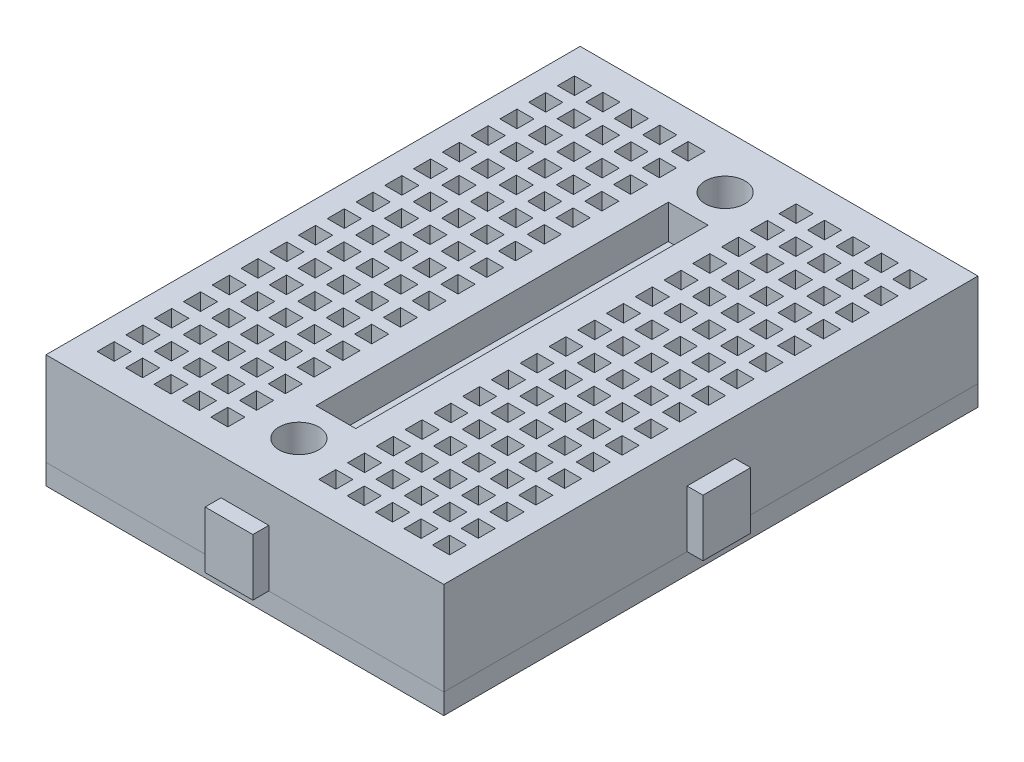
from build123d import *
from build123d.topology import SkipClean

# Parameters (mm, degrees)
SKETCH2_W           = 17.5
SKETCH2_H           = 47
BOSS_EXTRUDE1_DEPTH = 5.2
SKETCH3_W           = 1.5
SKETCH3_H           = 1.5
BOSS_EXTRUDE2_DEPTH = 3
SKETCH4_R           = 1
CUT_EXTRUDE1_DEPTH  = 30.758024128
SKETCH7_W           = 4.2
SKETCH7_H           = 5
BOSS_EXTRUDE4_DEPTH = 1.4
SKETCH8_W           = 4.2
SKETCH8_H           = 5
CUT_EXTRUDE2_DEPTH  = 1.7
SKETCH9_W           = 4.2
SKETCH9_H           = 5
BOSS_EXTRUDE5_DEPTH = 1.4
SKETCH10_W          = 4.2
SKETCH10_H          = 5
CUT_EXTRUDE3_DEPTH  = 1.7
SKETCH6_W           = 35
SKETCH6_H           = 47
ADHESIVE_DEPTH      = 1.8


with BuildPart() as part:
    # Sketch2 → Boss-Extrude1 (new body)
    with BuildSketch(Plane(origin=(0, 0, 0), x_dir=(1, 0, 0), z_dir=(0, 1, 0))):
        with Locations((-8.75, 0)):
            Rectangle(SKETCH2_W, SKETCH2_H)
    boss_extrude1 = extrude(amount=BOSS_EXTRUDE1_DEPTH)

    # Sketch3 → Boss-Extrude2 (add)
    with BuildSketch(Plane(origin=(0, 5.2, 0), x_dir=(1, 0, 0), z_dir=(0, 1, 0))):
        with BuildLine():
            Line((0, -17), (0, -15.5))
            Line((0, -15.5), (-1.75, -15.5))
            Line((-1.75, -15.5), (-1.75, 15.5))
            Line((-1.75, 15.5), (0, 15.5))
            Line((0, 15.5), (0, 17))
            ThreePointArc((0, 17), (-1.75, 18.75), (0, 20.5))
            Line((0, 20.5), (0, 23.5))
            Line((0, 23.5), (-17.5, 23.5))
            Line((-17.5, 23.5), (-17.5, -23.5))
            Line((-17.5, -23.5), (0, -23.5))
            Line((0, -23.5), (0, -20.5))
            ThreePointArc((0, -20.5), (-1.75, -18.75), (0, -17))
        make_face()
        with Locations((-14.75, -20.25)):
            Rectangle(SKETCH3_W, SKETCH3_H, mode=Mode.SUBTRACT)
        with Locations((-14.75, -17.71875)):
            Rectangle(SKETCH3_W, SKETCH3_H, mode=Mode.SUBTRACT)
        with Locations((-14.75, -15.1875)):
            Rectangle(SKETCH3_W, SKETCH3_H, mode=Mode.SUBTRACT)
        with Locations((-14.75, -12.65625)):
            Rectangle(SKETCH3_W, SKETCH3_H, mode=Mode.SUBTRACT)
        with Locations((-12.25, -20.25)):
            Rectangle(SKETCH3_W, SKETCH3_H, mode=Mode.SUBTRACT)
        with Locations((-12.25, -17.71875)):
            Rectangle(SKETCH3_W, SKETCH3_H, mode=Mode.SUBTRACT)
        with Locations((-9.75, -20.25)):
            Rectangle(SKETCH3_W, SKETCH3_H, mode=Mode.SUBTRACT)
        with Locations((-9.75, -17.71875)):
            Rectangle(SKETCH3_W, SKETCH3_H, mode=Mode.SUBTRACT)
        with Locations((-12.25, -15.1875)):
            Rectangle(SKETCH3_W, SKETCH3_H, mode=Mode.SUBTRACT)
        with Locations((-12.25, -12.65625)):
            Rectangle(SKETCH3_W, SKETCH3_H, mode=Mode.SUBTRACT)
        with Locations((-9.75, -15.1875)):
            Rectangle(SKETCH3_W, SKETCH3_H, mode=Mode.SUBTRACT)
        with Locations((-9.75, -12.65625)):
            Rectangle(SKETCH3_W, SKETCH3_H, mode=Mode.SUBTRACT)
        with Locations((-14.75, -10.125)):
            Rectangle(SKETCH3_W, SKETCH3_H, mode=Mode.SUBTRACT)
        with Locations((-14.75, -7.59375)):
            Rectangle(SKETCH3_W, SKETCH3_H, mode=Mode.SUBTRACT)
        with Locations((-14.75, -5.0625)):
            Rectangle(SKETCH3_W, SKETCH3_H, mode=Mode.SUBTRACT)
        with Locations((-14.75, -2.53125)):
            Rectangle(SKETCH3_W, SKETCH3_H, mode=Mode.SUBTRACT)
        with Locations((-12.25, -10.125)):
            Rectangle(SKETCH3_W, SKETCH3_H, mode=Mode.SUBTRACT)
        with Locations((-12.25, -7.59375)):
            Rectangle(SKETCH3_W, SKETCH3_H, mode=Mode.SUBTRACT)
        with Locations((-9.75, -10.125)):
            Rectangle(SKETCH3_W, SKETCH3_H, mode=Mode.SUBTRACT)
        with Locations((-9.75, -7.59375)):
            Rectangle(SKETCH3_W, SKETCH3_H, mode=Mode.SUBTRACT)
        with Locations((-12.25, -5.0625)):
            Rectangle(SKETCH3_W, SKETCH3_H, mode=Mode.SUBTRACT)
        with Locations((-12.25, -2.53125)):
            Rectangle(SKETCH3_W, SKETCH3_H, mode=Mode.SUBTRACT)
        with Locations((-9.75, -5.0625)):
            Rectangle(SKETCH3_W, SKETCH3_H, mode=Mode.SUBTRACT)
        with Locations((-9.75, -2.53125)):
            Rectangle(SKETCH3_W, SKETCH3_H, mode=Mode.SUBTRACT)
        with Locations((-7.25, -20.25)):
            Rectangle(SKETCH3_W, SKETCH3_H, mode=Mode.SUBTRACT)
        with Locations((-7.25, -17.71875)):
            Rectangle(SKETCH3_W, SKETCH3_H, mode=Mode.SUBTRACT)
        with Locations((-4.75, -20.25)):
            Rectangle(SKETCH3_W, SKETCH3_H, mode=Mode.SUBTRACT)
        with Locations((-4.75, -17.71875)):
            Rectangle(SKETCH3_W, SKETCH3_H, mode=Mode.SUBTRACT)
        with Locations((-7.25, -15.1875)):
            Rectangle(SKETCH3_W, SKETCH3_H, mode=Mode.SUBTRACT)
        with Locations((-7.25, -12.65625)):
            Rectangle(SKETCH3_W, SKETCH3_H, mode=Mode.SUBTRACT)
        with Locations((-4.75, -15.1875)):
            Rectangle(SKETCH3_W, SKETCH3_H, mode=Mode.SUBTRACT)
        with Locations((-4.75, -12.65625)):
            Rectangle(SKETCH3_W, SKETCH3_H, mode=Mode.SUBTRACT)
        with Locations((-7.25, -10.125)):
            Rectangle(SKETCH3_W, SKETCH3_H, mode=Mode.SUBTRACT)
        with Locations((-7.25, -7.59375)):
            Rectangle(SKETCH3_W, SKETCH3_H, mode=Mode.SUBTRACT)
        with Locations((-4.75, -10.125)):
            Rectangle(SKETCH3_W, SKETCH3_H, mode=Mode.SUBTRACT)
        with Locations((-4.75, -7.59375)):
            Rectangle(SKETCH3_W, SKETCH3_H, mode=Mode.SUBTRACT)
        with Locations((-7.25, -5.0625)):
            Rectangle(SKETCH3_W, SKETCH3_H, mode=Mode.SUBTRACT)
        with Locations((-7.25, -2.53125)):
            Rectangle(SKETCH3_W, SKETCH3_H, mode=Mode.SUBTRACT)
        with Locations((-4.75, -5.0625)):
            Rectangle(SKETCH3_W, SKETCH3_H, mode=Mode.SUBTRACT)
        with Locations((-4.75, -2.53125)):
            Rectangle(SKETCH3_W, SKETCH3_H, mode=Mode.SUBTRACT)
        with Locations((-14.75, 0)):
            Rectangle(SKETCH3_W, SKETCH3_H, mode=Mode.SUBTRACT)
        with Locations((-14.75, 2.53125)):
            Rectangle(SKETCH3_W, SKETCH3_H, mode=Mode.SUBTRACT)
        with Locations((-14.75, 5.0625)):
            Rectangle(SKETCH3_W, SKETCH3_H, mode=Mode.SUBTRACT)
        with Locations((-14.75, 7.59375)):
            Rectangle(SKETCH3_W, SKETCH3_H, mode=Mode.SUBTRACT)
        with Locations((-14.75, 10.125)):
            Rectangle(SKETCH3_W, SKETCH3_H, mode=Mode.SUBTRACT)
        with Locations((-12.25, 0)):
            Rectangle(SKETCH3_W, SKETCH3_H, mode=Mode.SUBTRACT)
        with Locations((-12.25, 2.53125)):
            Rectangle(SKETCH3_W, SKETCH3_H, mode=Mode.SUBTRACT)
        with Locations((-12.25, 5.0625)):
            Rectangle(SKETCH3_W, SKETCH3_H, mode=Mode.SUBTRACT)
        with Locations((-9.75, 0)):
            Rectangle(SKETCH3_W, SKETCH3_H, mode=Mode.SUBTRACT)
        with Locations((-9.75, 2.53125)):
            Rectangle(SKETCH3_W, SKETCH3_H, mode=Mode.SUBTRACT)
        with Locations((-9.75, 5.0625)):
            Rectangle(SKETCH3_W, SKETCH3_H, mode=Mode.SUBTRACT)
        with Locations((-12.25, 7.59375)):
            Rectangle(SKETCH3_W, SKETCH3_H, mode=Mode.SUBTRACT)
        with Locations((-12.25, 10.125)):
            Rectangle(SKETCH3_W, SKETCH3_H, mode=Mode.SUBTRACT)
        with Locations((-9.75, 7.59375)):
            Rectangle(SKETCH3_W, SKETCH3_H, mode=Mode.SUBTRACT)
        with Locations((-9.75, 10.125)):
            Rectangle(SKETCH3_W, SKETCH3_H, mode=Mode.SUBTRACT)
        with Locations((-14.75, 12.65625)):
            Rectangle(SKETCH3_W, SKETCH3_H, mode=Mode.SUBTRACT)
        with Locations((-14.75, 15.1875)):
            Rectangle(SKETCH3_W, SKETCH3_H, mode=Mode.SUBTRACT)
        with Locations((-14.75, 17.71875)):
            Rectangle(SKETCH3_W, SKETCH3_H, mode=Mode.SUBTRACT)
        with Locations((-14.75, 20.25)):
            Rectangle(SKETCH3_W, SKETCH3_H, mode=Mode.SUBTRACT)
        with Locations((-12.25, 12.65625)):
            Rectangle(SKETCH3_W, SKETCH3_H, mode=Mode.SUBTRACT)
        with Locations((-12.25, 15.1875)):
            Rectangle(SKETCH3_W, SKETCH3_H, mode=Mode.SUBTRACT)
        with Locations((-9.75, 12.65625)):
            Rectangle(SKETCH3_W, SKETCH3_H, mode=Mode.SUBTRACT)
        with Locations((-9.75, 15.1875)):
            Rectangle(SKETCH3_W, SKETCH3_H, mode=Mode.SUBTRACT)
        with Locations((-12.25, 17.71875)):
            Rectangle(SKETCH3_W, SKETCH3_H, mode=Mode.SUBTRACT)
        with Locations((-12.25, 20.25)):
            Rectangle(SKETCH3_W, SKETCH3_H, mode=Mode.SUBTRACT)
        with Locations((-9.75, 17.71875)):
            Rectangle(SKETCH3_W, SKETCH3_H, mode=Mode.SUBTRACT)
        with Locations((-9.75, 20.25)):
            Rectangle(SKETCH3_W, SKETCH3_H, mode=Mode.SUBTRACT)
        with Locations((-7.25, 0)):
            Rectangle(SKETCH3_W, SKETCH3_H, mode=Mode.SUBTRACT)
        with Locations((-7.25, 2.53125)):
            Rectangle(SKETCH3_W, SKETCH3_H, mode=Mode.SUBTRACT)
        with Locations((-7.25, 5.0625)):
            Rectangle(SKETCH3_W, SKETCH3_H, mode=Mode.SUBTRACT)
        with Locations((-4.75, 0)):
            Rectangle(SKETCH3_W, SKETCH3_H, mode=Mode.SUBTRACT)
        with Locations((-4.75, 2.53125)):
            Rectangle(SKETCH3_W, SKETCH3_H, mode=Mode.SUBTRACT)
        with Locations((-4.75, 5.0625)):
            Rectangle(SKETCH3_W, SKETCH3_H, mode=Mode.SUBTRACT)
        with Locations((-7.25, 7.59375)):
            Rectangle(SKETCH3_W, SKETCH3_H, mode=Mode.SUBTRACT)
        with Locations((-7.25, 10.125)):
            Rectangle(SKETCH3_W, SKETCH3_H, mode=Mode.SUBTRACT)
        with Locations((-4.75, 7.59375)):
            Rectangle(SKETCH3_W, SKETCH3_H, mode=Mode.SUBTRACT)
        with Locations((-4.75, 10.125)):
            Rectangle(SKETCH3_W, SKETCH3_H, mode=Mode.SUBTRACT)
        with Locations((-7.25, 12.65625)):
            Rectangle(SKETCH3_W, SKETCH3_H, mode=Mode.SUBTRACT)
        with Locations((-7.25, 15.1875)):
            Rectangle(SKETCH3_W, SKETCH3_H, mode=Mode.SUBTRACT)
        with Locations((-4.75, 12.65625)):
            Rectangle(SKETCH3_W, SKETCH3_H, mode=Mode.SUBTRACT)
        with Locations((-4.75, 15.1875)):
            Rectangle(SKETCH3_W, SKETCH3_H, mode=Mode.SUBTRACT)
        with Locations((-7.25, 17.71875)):
            Rectangle(SKETCH3_W, SKETCH3_H, mode=Mode.SUBTRACT)
        with Locations((-7.25, 20.25)):
            Rectangle(SKETCH3_W, SKETCH3_H, mode=Mode.SUBTRACT)
        with Locations((-4.75, 17.71875)):
            Rectangle(SKETCH3_W, SKETCH3_H, mode=Mode.SUBTRACT)
        with Locations((-4.75, 20.25)):
            Rectangle(SKETCH3_W, SKETCH3_H, mode=Mode.SUBTRACT)
    boss_extrude2 = extrude(amount=BOSS_EXTRUDE2_DEPTH)

    # Mirror1: Boss-Extrude1, Boss-Extrude2 across plane
    with SkipClean():  # the faces are left unmerged after this step: merging them gives an invalid solid
        add(boss_extrude1.mirror(Plane(origin=(0, 5.2, -23.5), x_dir=(0, 0, 1), z_dir=(-1, 0, 0))))
        add(boss_extrude2.mirror(Plane(origin=(0, 5.2, -23.5), x_dir=(0, 0, 1), z_dir=(-1, 0, 0))))

    # Sketch4 → Cut-Extrude1 (cut, through all)
    with SkipClean():  # the faces are left unmerged after this step: merging them gives an invalid solid
        with BuildSketch(Plane(origin=(0, 5.2, 0), x_dir=(1, 0, 0), z_dir=(0, 1, 0))):
            with Locations((0, 18.75)):
                Circle(SKETCH4_R)
            with Locations((0, -18.75)):
                Circle(SKETCH4_R)
        extrude(amount=-CUT_EXTRUDE1_DEPTH, mode=Mode.SUBTRACT)

    # Sketch7 → Boss-Extrude4 (add)
    with SkipClean():  # the faces are left unmerged after this step: merging them gives an invalid solid
        with BuildSketch(Plane.XY.offset(23.5)):
            with Locations((0, 2.5)):
                Rectangle(SKETCH7_W, SKETCH7_H)
        extrude(amount=BOSS_EXTRUDE4_DEPTH)

    # Sketch8 → Cut-Extrude2 (cut)
    with SkipClean():  # the faces are left unmerged after this step: merging them gives an invalid solid
        with BuildSketch(Plane(origin=(0, 0, -23.5), x_dir=(-1, 0, 0), z_dir=(0, 0, -1))):
            with Locations((0, 2.5)):
                Rectangle(SKETCH8_W, SKETCH8_H)
        extrude(amount=-CUT_EXTRUDE2_DEPTH, mode=Mode.SUBTRACT)

    # Sketch9 → Boss-Extrude5 (add)
    with SkipClean():  # the faces are left unmerged after this step: merging them gives an invalid solid
        with BuildSketch(Plane(origin=(17.5, 0, 0), x_dir=(0, 0, -1), z_dir=(1, 0, 0))):
            with Locations((0, 2.5)):
                Rectangle(SKETCH9_W, SKETCH9_H)
        extrude(amount=BOSS_EXTRUDE5_DEPTH)

    # Sketch10 → Cut-Extrude3 (cut)
    with SkipClean():  # the faces are left unmerged after this step: merging them gives an invalid solid
        with BuildSketch(Plane.ZY.offset(17.5)):
            with Locations((0, 2.5)):
                Rectangle(SKETCH10_W, SKETCH10_H)
        extrude(amount=-CUT_EXTRUDE3_DEPTH, mode=Mode.SUBTRACT)


with BuildPart() as body_2:
    # Sketch6 → Adhesive (new body)
    with BuildSketch(Plane.XZ):
        Rectangle(SKETCH6_W, SKETCH6_H)
    extrude(amount=ADHESIVE_DEPTH)


solid = Compound([part.part, body_2.part])
